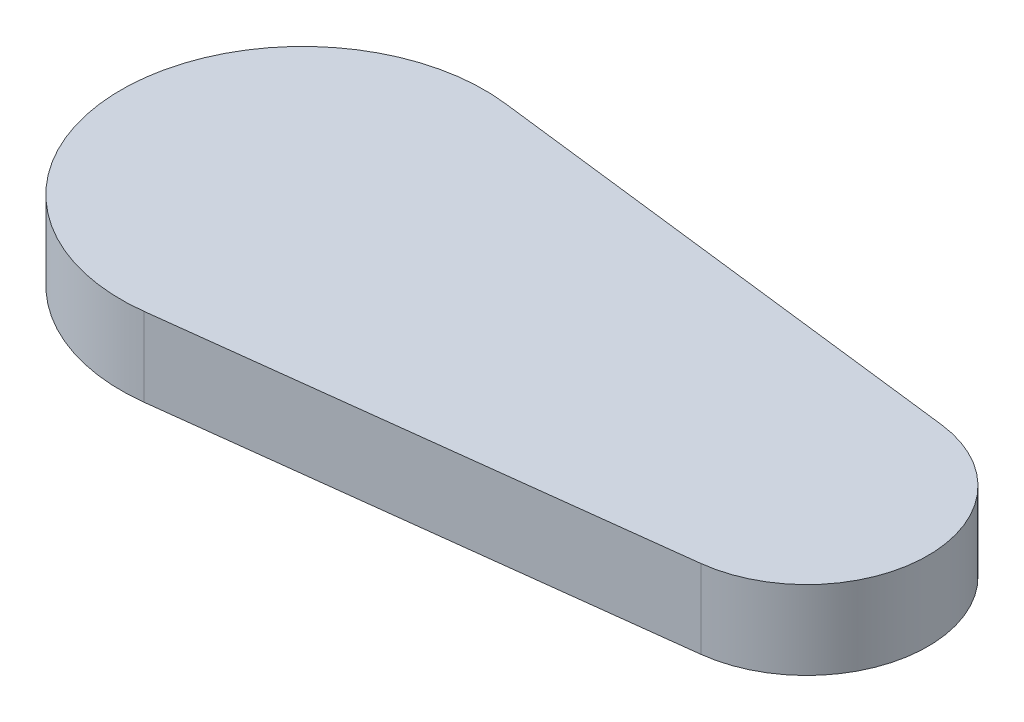
from build123d import *

# Parameters (mm, degrees)
BOSS_EXTRUDE1_DEPTH = 2.6


with BuildPart() as part:
    # Sketch1 → Boss-Extrude1 (new body)
    with BuildSketch(Plane(origin=(0, 0, 0), x_dir=(1, 0, 0), z_dir=(0, 1, 0))):
        with BuildLine():
            Line((17.13048048, 3.97103746), (0.720720721, 5.95655619))
            ThreePointArc((0.720720721, 5.95655619), (-6, 0), (0.720720721, -5.95655619))
            Line((0.720720721, -5.95655619), (17.13048048, -3.97103746))
            ThreePointArc((17.13048048, -3.97103746), (20.65, 0), (17.13048048, 3.97103746))
        make_face()
    extrude(amount=BOSS_EXTRUDE1_DEPTH)


solid = part.part
